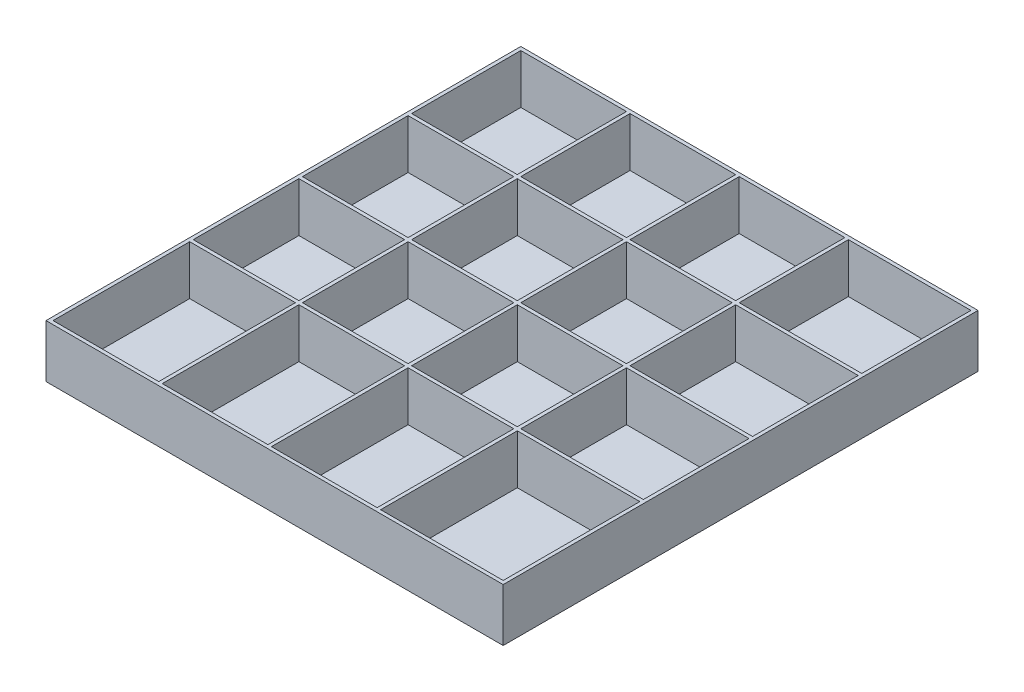
from build123d import *

# Parameters (mm, degrees)
SKETCH_1_W             = 259.6
SKETCH_1_H             = 269.6
EXTRUDE_1_DEPTH        = 2
SKETCH_2_W             = 259.6
SKETCH_2_H             = 269.6
SKETCH_2_W_2           = 255.6
SKETCH_2_H_2           = 265.6
EXTRUDE_2_DEPTH        = 28
SKETCH_3_W             = 2
SKETCH_3_H             = 265.6
EXTRUDE_3_DEPTH        = 28
PATTERN_LINEAR_1_COUNT = 3
PATTERN_LINEAR_1_PITCH = 62
SKETCH_4_W             = 255.6
SKETCH_4_H             = 2
EXTRUDE_5_DEPTH        = 28
PATTERN_LINEAR_2_COUNT = 3
PATTERN_LINEAR_2_PITCH = 62


with BuildPart() as part:
    # 草图1 → 凸台-拉伸1 (new body)
    with BuildSketch(Plane(origin=(0, 0, 0), x_dir=(1, 0, 0), z_dir=(0, 1, 0))):
        Rectangle(SKETCH_1_W, SKETCH_1_H)
    extrude(amount=EXTRUDE_1_DEPTH)

    # 草图2 → 凸台-拉伸2 (add)
    with BuildSketch(Plane(origin=(0, 2, 0), x_dir=(1, 0, 0), z_dir=(0, 1, 0))):
        Rectangle(SKETCH_2_W, SKETCH_2_H)
        Rectangle(SKETCH_2_W_2, SKETCH_2_H_2, mode=Mode.SUBTRACT)
    extrude(amount=EXTRUDE_2_DEPTH)

    # 草图3 → 凸台-拉伸3 (add)
    with BuildSketch(Plane(origin=(0, 2, 0), x_dir=(1, 0, 0), z_dir=(0, 1, 0))):
        with Locations((-66.8, 0)):
            Rectangle(SKETCH_3_W, SKETCH_3_H)
    extrude_3 = extrude(amount=EXTRUDE_3_DEPTH)

    # 阵列(线性)1: 凸台-拉伸3 ×3
    with Locations(*[(i * PATTERN_LINEAR_1_PITCH, 0, 0) for i in range(1, PATTERN_LINEAR_1_COUNT)]):
        add(extrude_3)

    # 草图4 → 凸台-拉伸5 (add)
    with BuildSketch(Plane(origin=(0, 2, 0), x_dir=(1, 0, 0), z_dir=(0, 1, 0))):
        with Locations((0, 69.8)):
            Rectangle(SKETCH_4_W, SKETCH_4_H)
    extrude_5 = extrude(amount=EXTRUDE_5_DEPTH)

    # 阵列(线性)2: 凸台-拉伸5 ×3
    with Locations(*[(0, 0, i * PATTERN_LINEAR_2_PITCH) for i in range(1, PATTERN_LINEAR_2_COUNT)]):
        add(extrude_5)


solid = part.part
